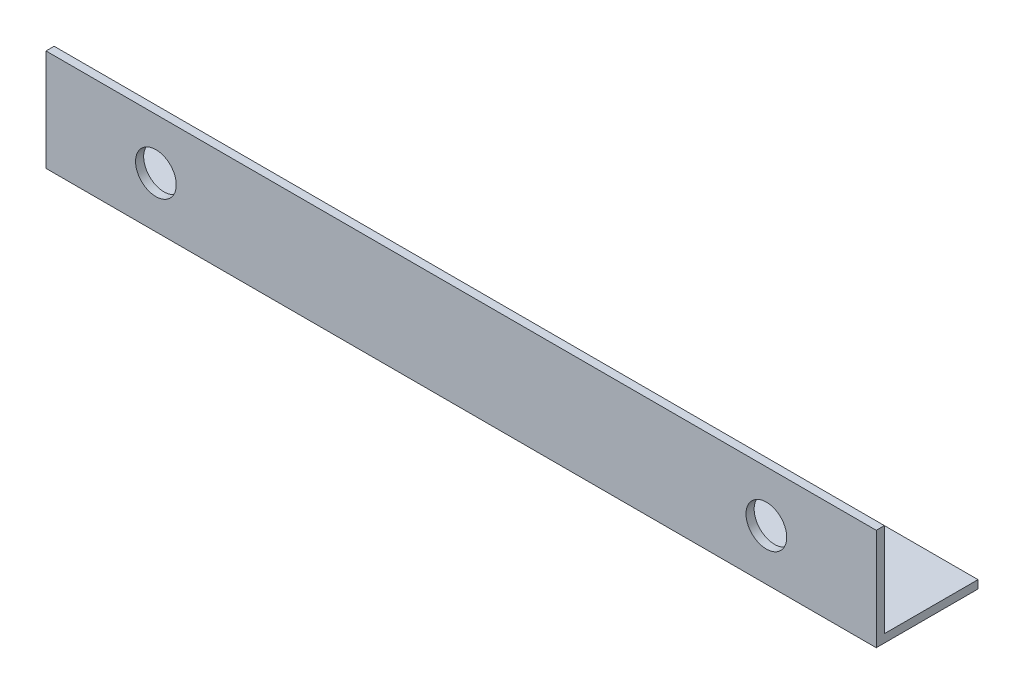
from build123d import *

# Parameters (mm, degrees)
EXTRUDE_1_DEPTH     = 204
SKETCH_2_R          = 5
CUT_EXTRUDE_1_DEPTH = 208.04105873


with BuildPart() as part:
    # Эскиз1 → Вытянуть-Тонкостенный1 (new body)
    with BuildSketch(Plane(origin=(0, 0, 0), x_dir=(0, 0, -1), z_dir=(1, 0, 0))):
        Polygon((0, 25), (0, 0), (25, 0), (25, 2), (2, 2), (2, 25), align=None)
    extrude(amount=EXTRUDE_1_DEPTH)

    # Эскиз2 → Вырез-Вытянуть1 (cut, through all)
    with BuildSketch(Plane.XY):
        with Locations((27, 12.5)):
            Circle(SKETCH_2_R)
        with Locations((177, 12.5)):
            Circle(SKETCH_2_R)
    extrude(amount=-CUT_EXTRUDE_1_DEPTH, mode=Mode.SUBTRACT)


solid = part.part
